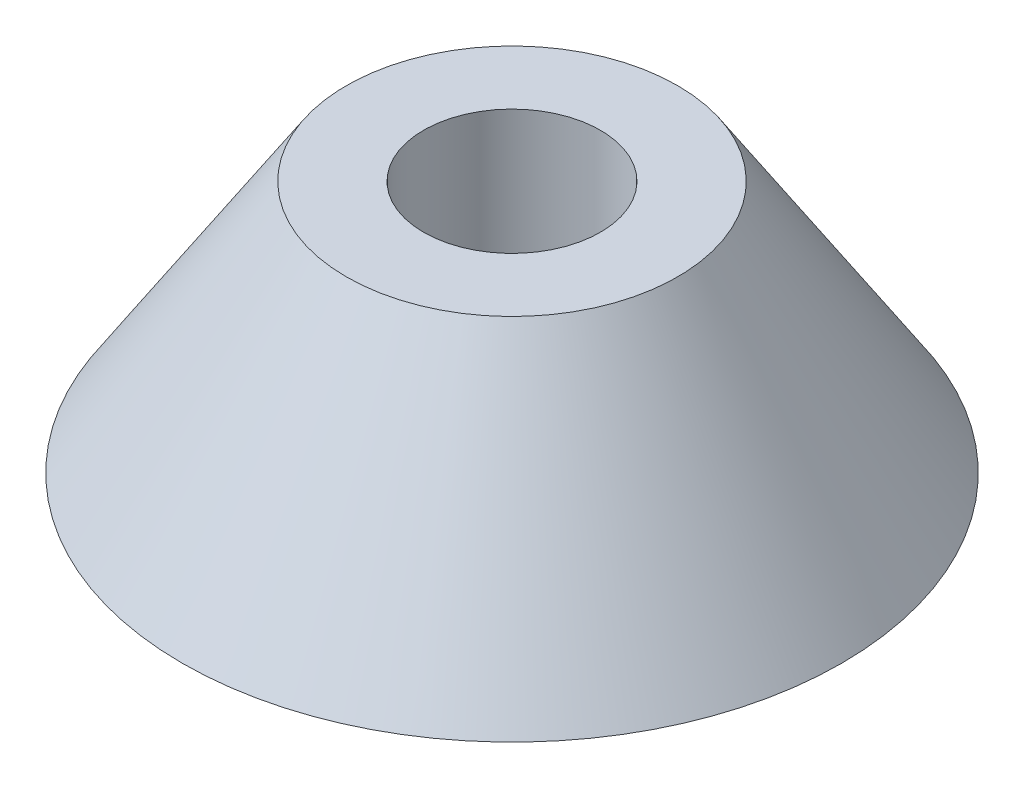
from build123d import *

# Parameters (mm, degrees)
SKETCH1_R           = 7.5
SKETCH1_R_2         = 1.75
BOSS_EXTRUDE1_DEPTH = 5
CHAMFER1_SIZE       = 6.5
CHAMFER1_SIZE_2     = 4.221149356


with BuildPart() as part:
    # Sketch1 → Boss-Extrude1 (new body)
    with BuildSketch(Plane(origin=(0, 0, 0), x_dir=(1, 0, 0), z_dir=(0, 1, 0))):
        with Locations(Location((0, 0, 0), (0, 0, 270))):
            Circle(SKETCH1_R)
        with Locations(Location((0, 0, 0), (0, 0, 270))):
            Circle(SKETCH1_R_2, mode=Mode.SUBTRACT)
    extrude(amount=BOSS_EXTRUDE1_DEPTH)

    # Chamfer1
    # the kernel refuses this chamfer: 6.5, 4.221149356 mm, written as the material it takes off along each edge
    with BuildSketch(Plane(origin=(0, 5, 0), x_dir=(0, 0, 1), z_dir=(-1, 0, 0))) as chamfer1_piece_1:
        Polygon((7.5, -CHAMFER1_SIZE), (7.5 - CHAMFER1_SIZE_2, 0), (7.5, 0), align=None)
    revolve(axis=Axis((0, 5, 0), (0, 1, 0)), mode=Mode.SUBTRACT)


solid = part.part
